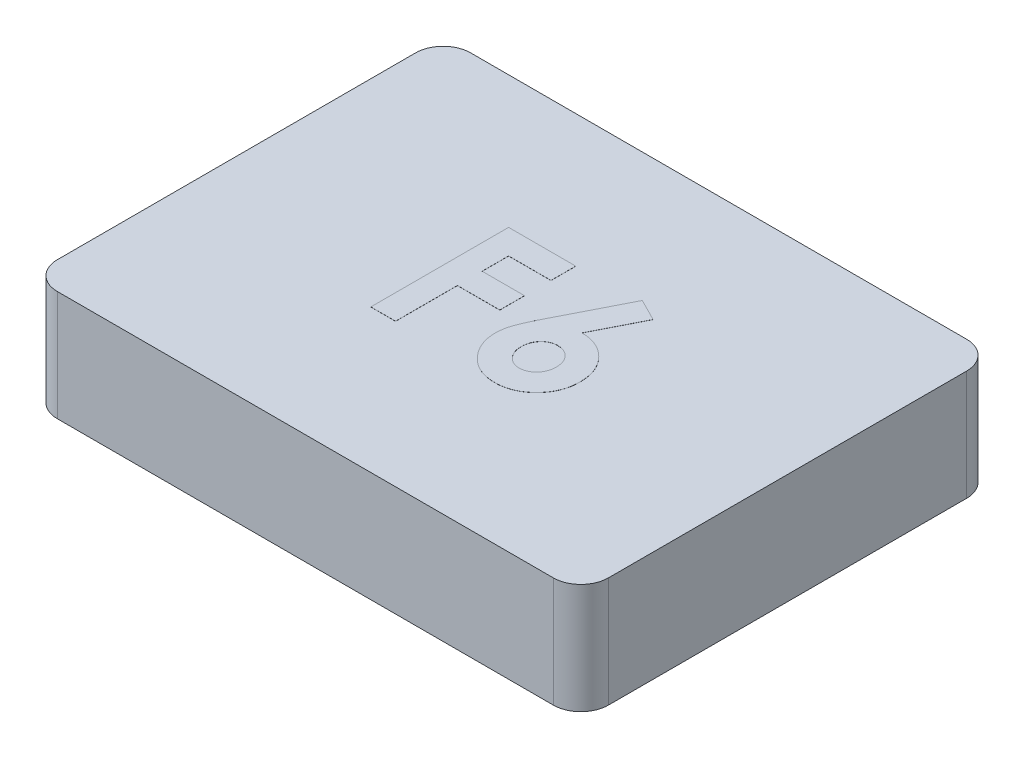
from build123d import *

# Parameters (mm, degrees)
SKETCH1_W           = 12.7
SKETCH1_H           = 9.525
BOSS_EXTRUDE1_DEPTH = 2.54
FILLET1_R           = 0.635
SHELL1_START        = 0.635
SHELL1_OUTLINE_W    = 1.905
SHELL1_OUTLINE_H    = 8.255
SHELL1_DEPTH        = 11.43
SKETCH2_R           = 2.54
BOSS_EXTRUDE2_DEPTH = 1.905
BOSS_EXTRUDE3_DEPTH = 0.00254


# Read off the part's stored shape, not the designer's step: Shell1
with BuildPart() as part:
    # Sketch1 → Boss-Extrude1 (new body)
    with BuildSketch(Plane(origin=(0, 0, 0), x_dir=(1, 0, 0), z_dir=(0, 1, 0))):
        with Locations((6.35, 4.7625)):
            Rectangle(SKETCH1_W, SKETCH1_H)
    extrude(amount=BOSS_EXTRUDE1_DEPTH)

    # Fillet1
    fillet1_edges = [part.edges().sort_by_distance(p)[0] for p in [
        (0, 1.27, -9.525),
        (12.7, 1.27, -9.525),
        (12.7, 1.27, 0),
        (0, 1.27, 0),
    ]]
    fillet(fillet1_edges, radius=FILLET1_R)

    # Shell1 outline → Shell1 (cut)
    with BuildSketch(Plane.YZ.offset(SHELL1_START)):
        with Locations((0.9525, -4.7625)):
            Rectangle(SHELL1_OUTLINE_W, SHELL1_OUTLINE_H)
    extrude(amount=SHELL1_DEPTH, mode=Mode.SUBTRACT)

    # Sketch2 → Boss-Extrude2 (add)
    with BuildSketch(Plane(origin=(0, 1.905, 0), x_dir=(-1, 0, 0), z_dir=(0, -1, 0))):
        with Locations(Location((-6.35, 4.7625, 0), (0, 0, 270))):
            Circle(SKETCH2_R)
    extrude(amount=BOSS_EXTRUDE2_DEPTH)

    # Sketch3 → Boss-Extrude3 (add)
    # profile 1 of 2: a face of its own
    with BuildSketch(Plane(origin=(0, 2.54, 0), x_dir=(1, 0, 0), z_dir=(0, 1, 0))):
        Polygon((4.557346154, 6.477), (6.104141026, 6.477), (6.104141026, 5.907128205), (5.127217949, 5.907128205), (5.127217949, 5.296551282), (6.104141026, 5.296551282), (6.104141026, 4.726679487), (5.127217949, 4.726679487), (5.127217949, 3.302), (4.557346154, 3.302), align=None)
    # profile 2 of 2: a face of its own
    with BuildSketch(Plane(origin=(0, 2.54, 0), x_dir=(1, 0, 0), z_dir=(0, 1, 0))):
        with BuildLine():
            Line((7.556805288, 6.558410256), (8.061167268, 6.30273117))
            Line((8.061167268, 6.30273117), (7.507831931, 5.215141026))
            add(Edge.make_bspline(
                [(7.507831931, 5.215141026), (7.540522464, 5.214294651), (7.604911828, 5.212627578), (7.699647713, 5.199154014), (7.790216983, 5.175861453), (7.877532843, 5.144987227), (7.96052794, 5.103522834), (8.040538956, 5.054198775), (8.115495965, 4.99404278), (8.187117669, 4.92739313), (8.252242916, 4.853554895), (8.308815707, 4.774213367), (8.358117895, 4.691298934), (8.396443432, 4.602956598), (8.427358086, 4.510650736), (8.44966437, 4.41401236), (8.462390729, 4.312761626), (8.46414527, 4.243977417), (8.465038462, 4.208961138)],
                knots=[0, 0, 0, 0, 1.013260694, 1.995783107, 2.958651975, 3.908806537, 4.861209129, 5.829647963, 6.817170299, 7.835534541, 8.860094905, 9.863329007, 10.853101798, 11.844815043, 12.84250023, 13.867713965, 14.914507806, 16, 16, 16, 16], degree=3))
            add(Edge.make_bspline(
                [(8.465038462, 4.208961138), (8.464201467, 4.175207569), (8.462547087, 4.108491238), (8.448871451, 4.010501914), (8.426770904, 3.916486889), (8.395184784, 3.826633922), (8.355036272, 3.740503809), (8.30593736, 3.658147091), (8.24748087, 3.580179194), (8.181177155, 3.507014401), (8.108695756, 3.440324152), (8.032296413, 3.381045977), (7.951331729, 3.332079955), (7.867332031, 3.290727002), (7.778750832, 3.259868741), (7.686913754, 3.236576099), (7.591124371, 3.223135234), (7.526104992, 3.22144503), (7.493203526, 3.220589744)],
                knots=[0, 0, 0, 0, 1.049934834, 2.075270938, 3.072134561, 4.05064612, 5.033440221, 6.024524368, 7.028587226, 8.060776465, 9.092543989, 10.090062252, 11.064205434, 12.031961459, 12.998029633, 13.977230324, 14.976426867, 16, 16, 16, 16], degree=3))
            add(Edge.make_bspline(
                [(7.493203526, 3.220589744), (7.45879859, 3.221291632), (7.391145938, 3.2226718), (7.292153178, 3.238126046), (7.197210601, 3.261390259), (7.1068518, 3.294607602), (7.02051486, 3.336903587), (6.939216244, 3.389240616), (6.862271123, 3.451041549), (6.790499844, 3.520915965), (6.725839271, 3.597453826), (6.668167444, 3.676920054), (6.619377003, 3.759439347), (6.579882279, 3.844923478), (6.54906758, 3.933100047), (6.527626834, 4.024136406), (6.513656209, 4.11779108), (6.512018472, 4.181350442), (6.511192308, 4.213413261)],
                knots=[0, 0, 0, 0, 1.063775006, 2.091769615, 3.092589432, 4.084662827, 5.064601646, 6.061867366, 7.070035304, 8.113879863, 9.156342271, 10.166834137, 11.149076039, 12.117706134, 13.076241869, 14.034148791, 15.008317125, 16, 16, 16, 16], degree=3))
            add(Edge.make_bspline(
                [(6.511192308, 4.213413261), (6.511628837, 4.238242164), (6.512504324, 4.288038176), (6.521302452, 4.362604999), (6.534678698, 4.437367552), (6.550183517, 4.500454562), (6.566148814, 4.553801232), (6.582218008, 4.598947076), (6.602132233, 4.649049092), (6.624897142, 4.70423522), (6.651228609, 4.764439071), (6.680989082, 4.829496544), (6.714252653, 4.899900304), (6.73797416, 4.948256786), (6.750334936, 4.973454327)],
                knots=[0, 0, 0, 0, 1.110454016, 2.227089276, 3.35462975, 4.507227546, 5.131400587, 5.845402449, 6.650387134, 7.543487832, 8.516250726, 9.590168902, 10.744287919, 12, 12, 12, 12], degree=3))
            Line((6.750334936, 4.973454327), (7.556805288, 6.558410256))
        make_face()
        with BuildLine():
            add(Edge.make_bspline(
                [(7.480483173, 4.685974359), (7.45313899, 4.684720139), (7.399630013, 4.682265795), (7.32354825, 4.656562713), (7.254178944, 4.616240974), (7.194048771, 4.560085155), (7.143755415, 4.492976745), (7.106798092, 4.416430641), (7.084566208, 4.331468327), (7.082256458, 4.272064094), (7.081064103, 4.241398037)],
                knots=[0, 0, 0, 0, 0.981744412, 1.921144944, 2.858899012, 3.85339082, 4.86292663, 5.863643845, 6.897155691, 8, 8, 8, 8], degree=3))
            add(Edge.make_bspline(
                [(7.081064103, 4.241398037), (7.082475888, 4.210721768), (7.085221906, 4.151054373), (7.108289737, 4.065283067), (7.146058935, 3.986998689), (7.199027827, 3.919000948), (7.261212545, 3.862557558), (7.330168021, 3.820814972), (7.404744054, 3.795171132), (7.456330117, 3.792042243), (7.482391226, 3.790461538)],
                knots=[0, 0, 0, 0, 1.098279937, 2.136227893, 3.159405121, 4.194678092, 5.206500211, 6.154139736, 7.067477469, 8, 8, 8, 8], degree=3))
            add(Edge.make_bspline(
                [(7.482391226, 3.790461538), (7.509914703, 3.792070396), (7.563893022, 3.795225646), (7.641760287, 3.81979044), (7.7128925, 3.860833701), (7.775787137, 3.917096382), (7.829812434, 3.984318178), (7.867192483, 4.063062388), (7.89132675, 4.149452761), (7.893857997, 4.210062449), (7.895166667, 4.241398037)],
                knots=[0, 0, 0, 0, 0.96921794, 1.900804717, 2.848419905, 3.844199796, 4.861108892, 5.867439427, 6.897452859, 8, 8, 8, 8], degree=3))
            add(Edge.make_bspline(
                [(7.895166667, 4.241398037), (7.893675852, 4.272046189), (7.890788716, 4.331399913), (7.869102903, 4.416760256), (7.830384348, 4.493011323), (7.778953064, 4.560362168), (7.71675353, 4.616492947), (7.644607923, 4.656880703), (7.565050618, 4.682220258), (7.509083321, 4.684704747), (7.480483173, 4.685974359)],
                knots=[0, 0, 0, 0, 1.083229974, 2.097801324, 3.086792542, 4.086858909, 5.079819718, 6.026392613, 6.991456328, 8, 8, 8, 8], degree=3))
        make_face(mode=Mode.SUBTRACT)
    extrude(amount=BOSS_EXTRUDE3_DEPTH)


solid = part.part
